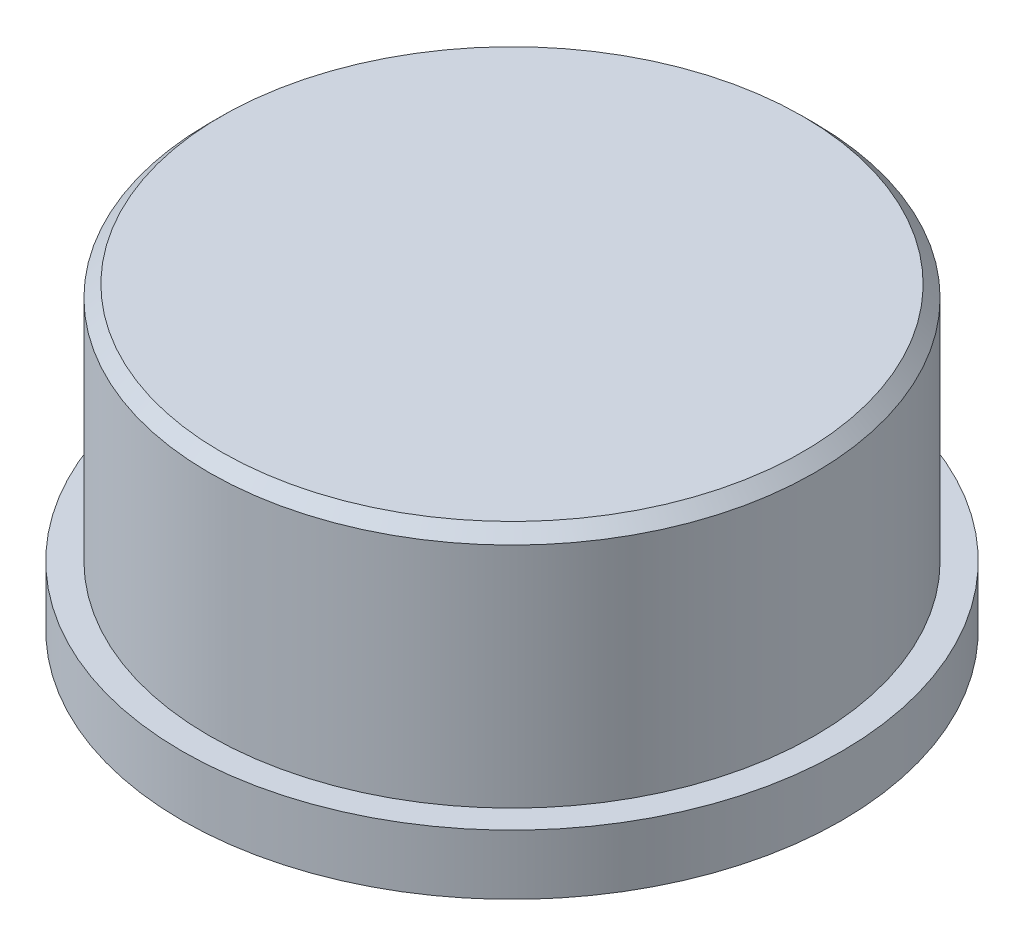
from build123d import *

# Parameters (mm, degrees)
SKETCH1_R           = 5.5
BOSS_EXTRUDE1_DEPTH = 1
SKETCH2_R           = 5.05
BOSS_EXTRUDE2_DEPTH = 4
CUT_EXTRUDE1_DEPTH  = 4
CHAMFER1_SIZE       = 0.2


with BuildPart() as part:
    # Sketch1 → Boss-Extrude1 (new body)
    with BuildSketch(Plane(origin=(0, 0, 0), x_dir=(1, 0, 0), z_dir=(0, 1, 0))):
        Circle(SKETCH1_R)
    extrude(amount=BOSS_EXTRUDE1_DEPTH)

    # Sketch2 → Boss-Extrude2 (add)
    with BuildSketch(Plane(origin=(0, 1, 0), x_dir=(1, 0, 0), z_dir=(0, 1, 0))):
        Circle(SKETCH2_R)
    extrude(amount=BOSS_EXTRUDE2_DEPTH)

    # Sketch3 → Cut-Extrude1 (cut)
    with BuildSketch(Plane.XZ):
        Polygon((3.0022214, 0), (1.5011107, 2.6), (-1.5011107, 2.6), (-3.0022214, 0), (-1.5011107, -2.6), (1.5011107, -2.6), align=None)
    extrude(amount=-CUT_EXTRUDE1_DEPTH, mode=Mode.SUBTRACT)

    # Chamfer1
    chamfer1_edges = [part.edges().sort_by_distance(p)[0] for p in [
        (-5.05, 5, 0),
    ]]
    chamfer(chamfer1_edges, length=CHAMFER1_SIZE)


solid = part.part
